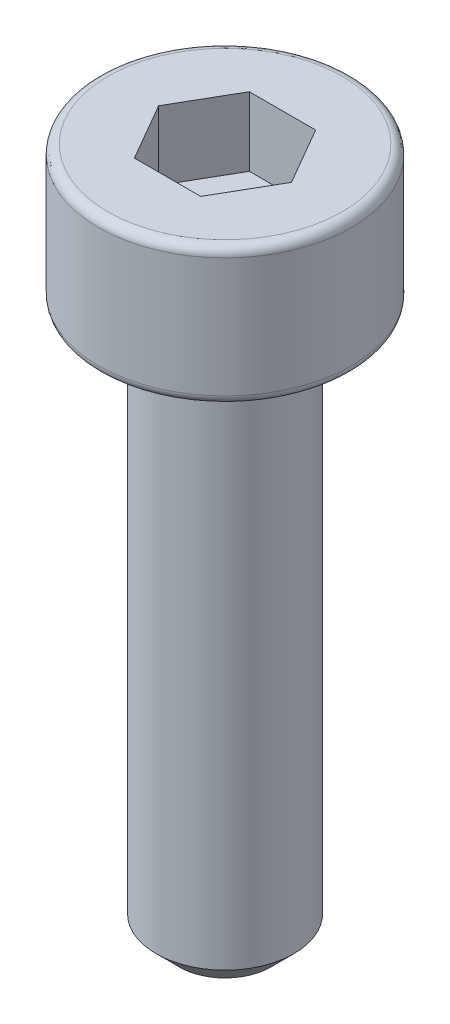
from build123d import *

# Parameters (mm, degrees)
SKETCH1_R           = 2.75
BOSS_EXTRUDE1_DEPTH = 3
CUT_EXTRUDE1_DEPTH  = 1.5
SKETCH3_R           = 1.5
BOSS_EXTRUDE2_DEPTH = 0.0001
SKETCH4_R           = 1.5
BOSS_EXTRUDE3_DEPTH = 12
CHAMFER1_SIZE       = 0.5
FILLET1_R           = 0.2


with BuildPart() as part:
    # Sketch1 → Boss-Extrude1 (new body)
    with BuildSketch(Plane(origin=(0, 0, 0), x_dir=(1, 0, 0), z_dir=(0, 1, 0))):
        Circle(SKETCH1_R)
    extrude(amount=-BOSS_EXTRUDE1_DEPTH)

    # Sketch2 → Cut-Extrude1 (cut)
    with BuildSketch(Plane(origin=(0, 0, 0), x_dir=(1, 0, 0), z_dir=(0, 1, 0))):
        Polygon((1.443375673, 0), (0.721687836, 1.25), (-0.721687836, 1.25), (-1.443375673, 0), (-0.721687836, -1.25), (0.721687836, -1.25), align=None)
    extrude(amount=-CUT_EXTRUDE1_DEPTH, mode=Mode.SUBTRACT)

    # Sketch3 → Boss-Extrude2 (add)
    with BuildSketch(Plane.XZ.offset(3)):
        Circle(SKETCH3_R)
    extrude(amount=BOSS_EXTRUDE2_DEPTH)

    # Fillet1
    fillet1_edges = [part.edges().sort_by_distance(p)[0] for p in [
        (-2.75, -3, 0),
        (-2.75, 0, 0),
    ]]
    fillet(fillet1_edges, radius=FILLET1_R)


with BuildPart() as body_2:
    # Sketch4 → Boss-Extrude3 (new body)
    with BuildSketch(Plane.XZ.offset(3.0001)):
        Circle(SKETCH4_R)
    extrude(amount=BOSS_EXTRUDE3_DEPTH)

    # Chamfer1
    chamfer1_edges = [body_2.edges().sort_by_distance(p)[0] for p in [
        (-1.5, -15.0001, 0),
    ]]
    chamfer(chamfer1_edges, length=CHAMFER1_SIZE)


solid = Compound([part.part, body_2.part])
